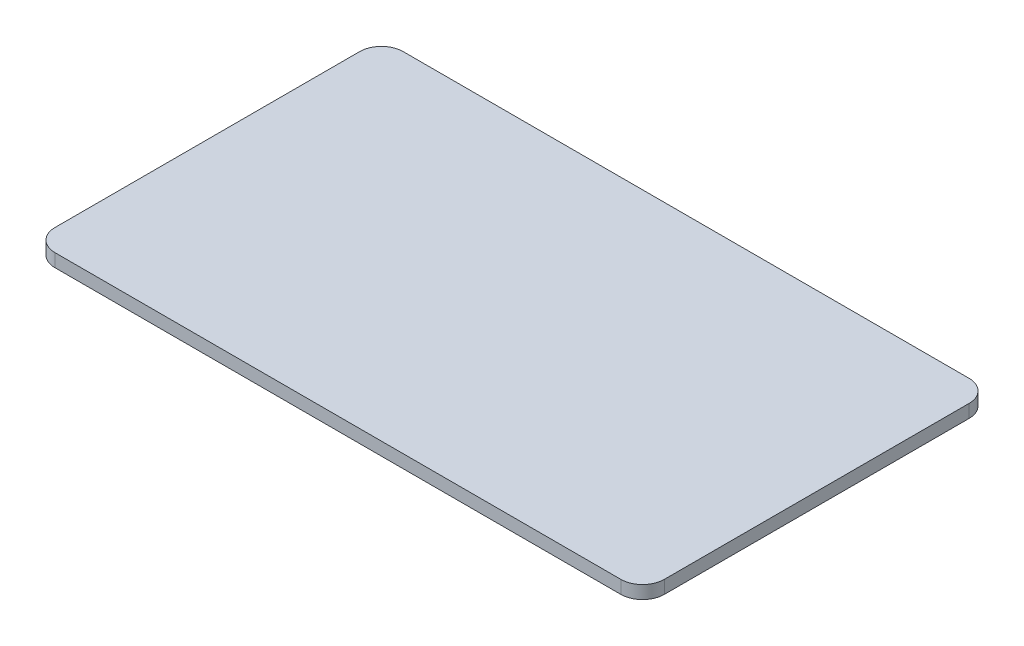
from build123d import *

# Parameters (mm, degrees)
SKETCH_1_W      = 70
SKETCH_1_H      = 40
EXTRUDE_1_DEPTH = 1.5
FILLET_1_R      = 2.5


with BuildPart() as part:
    # Эскиз1 → Бобышка-Вытянуть1 (new body)
    with BuildSketch(Plane(origin=(0, 0, 0), x_dir=(1, 0, 0), z_dir=(0, 1, 0))):
        Rectangle(SKETCH_1_W, SKETCH_1_H)
    extrude(amount=EXTRUDE_1_DEPTH)

    # Скругление1
    fillet_1_edges = [part.edges().sort_by_distance(p)[0] for p in [
        (-35, 0.75, -20),
        (35, 0.75, -20),
        (35, 0.75, 20),
        (-35, 0.75, 20),
    ]]
    fillet(fillet_1_edges, radius=FILLET_1_R)


solid = part.part
